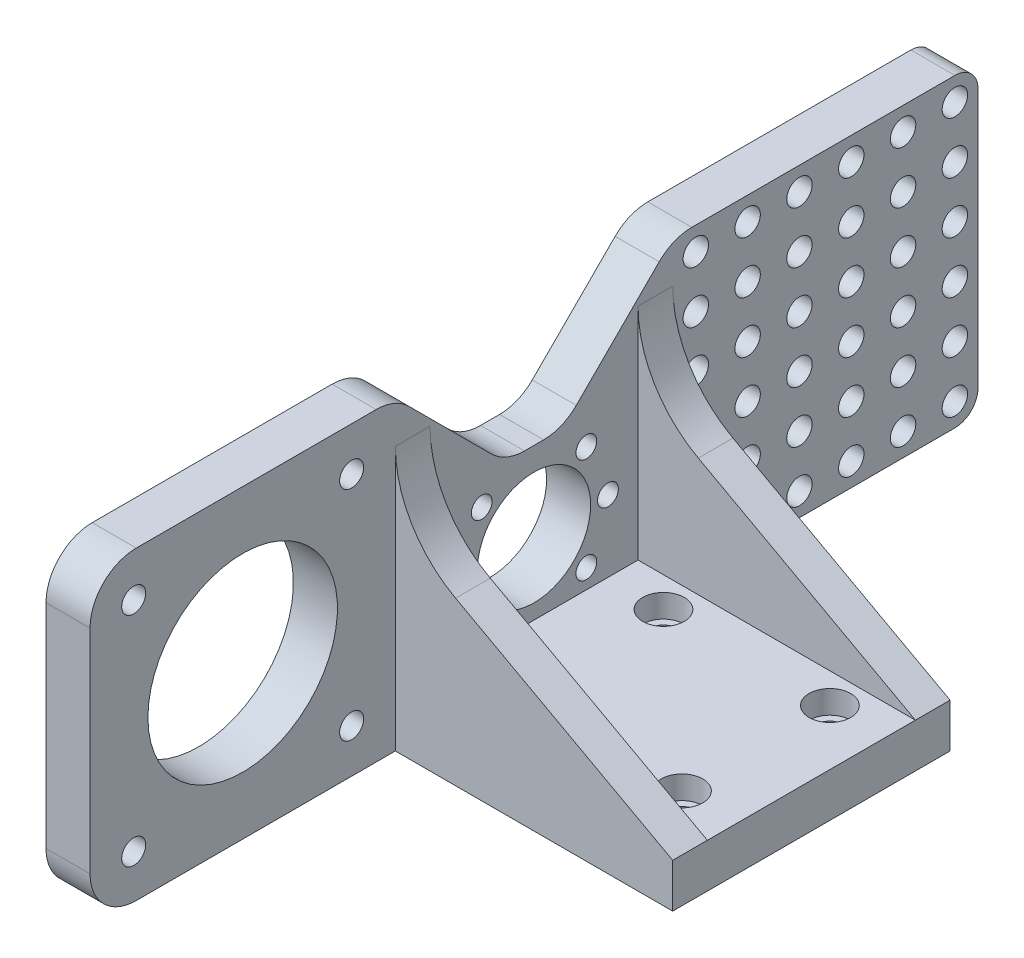
from build123d import *

# Parameters (mm, degrees)
SKETCH1_W           = 60
SKETCH1_H           = 60
SKETCH1_R           = 2.95
BOSS_EXTRUDE1_DEPTH = 9.525
SKETCH2_R           = 4.5
CUT_EXTRUDE1_DEPTH  = 5
SKETCH3_W           = 60
SKETCH3_H           = 42.25
SKETCH3_R           = 12.25
SKETCH3_R_2         = 2.25
BOSS_EXTRUDE2_DEPTH = 9.525
SKETCH4_W           = 66.04
SKETCH4_H           = 66.04
SKETCH4_R           = 2.6
SKETCH4_R_2         = 20.5
SKETCH4_R_3         = 2.75
BOSS_EXTRUDE3_DEPTH = 9.525
BOSS_EXTRUDE4_DEPTH = 7.5
CHAMFER1_SIZE       = 23.79
FILLET1_R           = 10
FILLET2_R           = 5
FILLET3_R           = 25


with BuildPart() as part:
    # Sketch1 → Boss-Extrude1 (new body)
    with BuildSketch(Plane(origin=(0, 0, 0), x_dir=(1, 0, 0), z_dir=(0, 1, 0))):
        with Locations((30, 30)):
            Rectangle(SKETCH1_W, SKETCH1_H)
        with Locations(Location((12, 14, 0), (0, 0, 90))):
            Circle(SKETCH1_R, mode=Mode.SUBTRACT)
        with Locations(Location((12, 46, 0), (0, 0, 90))):
            Circle(SKETCH1_R, mode=Mode.SUBTRACT)
        with Locations(Location((48, 46, 0), (0, 0, 90))):
            Circle(SKETCH1_R, mode=Mode.SUBTRACT)
        with Locations(Location((48, 14, 0), (0, 0, 90))):
            Circle(SKETCH1_R, mode=Mode.SUBTRACT)
    extrude(amount=BOSS_EXTRUDE1_DEPTH)

    # Sketch2 → Cut-Extrude1 (cut)
    with BuildSketch(Plane(origin=(0, 9.525, 0), x_dir=(1, 0, 0), z_dir=(0, 1, 0))):
        with Locations(Location((12, 14, 0), (0, 0, 270))):
            Circle(SKETCH2_R)
        with Locations(Location((12, 46, 0), (0, 0, 270))):
            Circle(SKETCH2_R)
        with Locations(Location((48, 46, 0), (0, 0, 270))):
            Circle(SKETCH2_R)
        with Locations(Location((48, 14, 0), (0, 0, 270))):
            Circle(SKETCH2_R)
    extrude(amount=-CUT_EXTRUDE1_DEPTH, mode=Mode.SUBTRACT)

    # Sketch3 → Boss-Extrude2 (add)
    with BuildSketch(Plane.ZY):
        with Locations((-30, 21.125)):
            Rectangle(SKETCH3_W, SKETCH3_H)
        with Locations(Location((-30, 25, 0), (0, 0, 180))):
            Circle(SKETCH3_R, mode=Mode.SUBTRACT)
        with Locations(Location((-18.686291501, 36.313708499, 0), (0, 0, 180))):
            Circle(SKETCH3_R_2, mode=Mode.SUBTRACT)
        with Locations(Location((-14, 25, 0), (0, 0, 180))):
            Circle(SKETCH3_R_2, mode=Mode.SUBTRACT)
        with Locations(Location((-18.686291501, 13.686291501, 0), (0, 0, 180))):
            Circle(SKETCH3_R_2, mode=Mode.SUBTRACT)
        with Locations(Location((-41.313708499, 13.686291501, 0), (0, 0, 180))):
            Circle(SKETCH3_R_2, mode=Mode.SUBTRACT)
        with Locations(Location((-46, 25, 0), (0, 0, 180))):
            Circle(SKETCH3_R_2, mode=Mode.SUBTRACT)
        with Locations(Location((-41.313708499, 36.313708499, 0), (0, 0, 180))):
            Circle(SKETCH3_R_2, mode=Mode.SUBTRACT)
    extrude(amount=BOSS_EXTRUDE2_DEPTH)

    # Sketch4 → Boss-Extrude3 (add)
    # profile 1 of 2: a face of its own
    with BuildSketch(Plane.ZY.offset(9.525)):
        with Locations((33.02, 33.02)):
            Rectangle(SKETCH4_W, SKETCH4_H)
        with Locations((56.59, 56.59)):
            Circle(SKETCH4_R, mode=Mode.SUBTRACT)
        with Locations((9.45, 56.59)):
            Circle(SKETCH4_R, mode=Mode.SUBTRACT)
        with Locations((9.45, 9.45)):
            Circle(SKETCH4_R, mode=Mode.SUBTRACT)
        with Locations((56.59, 9.45)):
            Circle(SKETCH4_R, mode=Mode.SUBTRACT)
        with Locations((33.02, 33.02)):
            Circle(SKETCH4_R_2, mode=Mode.SUBTRACT)
    # profile 2 of 2: a face of its own
    with BuildSketch(Plane.ZY.offset(9.525)):
        with Locations((-93.02, 33.02)):
            Rectangle(SKETCH4_W, SKETCH4_H)
        with Locations((-121.04, 61.04)):
            Circle(SKETCH4_R_3, mode=Mode.SUBTRACT)
        with Locations((-109.832, 61.04)):
            Circle(SKETCH4_R_3, mode=Mode.SUBTRACT)
        with Locations((-98.624, 61.04)):
            Circle(SKETCH4_R_3, mode=Mode.SUBTRACT)
        with Locations((-87.416, 61.04)):
            Circle(SKETCH4_R_3, mode=Mode.SUBTRACT)
        with Locations((-76.208, 61.04)):
            Circle(SKETCH4_R_3, mode=Mode.SUBTRACT)
        with Locations((-65, 61.04)):
            Circle(SKETCH4_R_3, mode=Mode.SUBTRACT)
        with Locations((-109.832, 49.832)):
            Circle(SKETCH4_R_3, mode=Mode.SUBTRACT)
        with Locations((-98.624, 49.832)):
            Circle(SKETCH4_R_3, mode=Mode.SUBTRACT)
        with Locations((-87.416, 49.832)):
            Circle(SKETCH4_R_3, mode=Mode.SUBTRACT)
        with Locations((-76.208, 49.832)):
            Circle(SKETCH4_R_3, mode=Mode.SUBTRACT)
        with Locations((-65, 49.832)):
            Circle(SKETCH4_R_3, mode=Mode.SUBTRACT)
        with Locations((-109.832, 38.624)):
            Circle(SKETCH4_R_3, mode=Mode.SUBTRACT)
        with Locations((-98.624, 38.624)):
            Circle(SKETCH4_R_3, mode=Mode.SUBTRACT)
        with Locations((-87.416, 38.624)):
            Circle(SKETCH4_R_3, mode=Mode.SUBTRACT)
        with Locations((-76.208, 38.624)):
            Circle(SKETCH4_R_3, mode=Mode.SUBTRACT)
        with Locations((-65, 38.624)):
            Circle(SKETCH4_R_3, mode=Mode.SUBTRACT)
        with Locations((-109.832, 27.416)):
            Circle(SKETCH4_R_3, mode=Mode.SUBTRACT)
        with Locations((-98.624, 27.416)):
            Circle(SKETCH4_R_3, mode=Mode.SUBTRACT)
        with Locations((-87.416, 27.416)):
            Circle(SKETCH4_R_3, mode=Mode.SUBTRACT)
        with Locations((-76.208, 27.416)):
            Circle(SKETCH4_R_3, mode=Mode.SUBTRACT)
        with Locations((-65, 27.416)):
            Circle(SKETCH4_R_3, mode=Mode.SUBTRACT)
        with Locations((-109.832, 16.208)):
            Circle(SKETCH4_R_3, mode=Mode.SUBTRACT)
        with Locations((-98.624, 16.208)):
            Circle(SKETCH4_R_3, mode=Mode.SUBTRACT)
        with Locations((-87.416, 16.208)):
            Circle(SKETCH4_R_3, mode=Mode.SUBTRACT)
        with Locations((-76.208, 16.208)):
            Circle(SKETCH4_R_3, mode=Mode.SUBTRACT)
        with Locations((-65, 16.208)):
            Circle(SKETCH4_R_3, mode=Mode.SUBTRACT)
        with Locations((-109.832, 5)):
            Circle(SKETCH4_R_3, mode=Mode.SUBTRACT)
        with Locations((-98.624, 5)):
            Circle(SKETCH4_R_3, mode=Mode.SUBTRACT)
        with Locations((-87.416, 5)):
            Circle(SKETCH4_R_3, mode=Mode.SUBTRACT)
        with Locations((-76.208, 5)):
            Circle(SKETCH4_R_3, mode=Mode.SUBTRACT)
        with Locations((-65, 5)):
            Circle(SKETCH4_R_3, mode=Mode.SUBTRACT)
        with Locations((-121.04, 49.832)):
            Circle(SKETCH4_R_3, mode=Mode.SUBTRACT)
        with Locations((-121.04, 38.624)):
            Circle(SKETCH4_R_3, mode=Mode.SUBTRACT)
        with Locations((-121.04, 27.416)):
            Circle(SKETCH4_R_3, mode=Mode.SUBTRACT)
        with Locations((-121.04, 16.208)):
            Circle(SKETCH4_R_3, mode=Mode.SUBTRACT)
        with Locations((-121.04, 5)):
            Circle(SKETCH4_R_3, mode=Mode.SUBTRACT)
    extrude(amount=-BOSS_EXTRUDE3_DEPTH)

    # Sketch5 → Boss-Extrude4 (add)
    with BuildSketch(Plane.XY):
        Polygon((60, 9.525), (0, 42.25), (0, 9.525), align=None)
    boss_extrude4 = extrude(amount=-BOSS_EXTRUDE4_DEPTH)

    # Mirror1: Boss-Extrude4 across plane
    add(boss_extrude4.mirror(Plane.XY.offset(-30)))

    # Chamfer1
    # the kernel refuses this chamfer: 23.79 mm, written as the material it adds along each edge
    with BuildSketch(Plane(origin=(0, 42.25, -60), x_dir=(0, 0.9996219169112968, -0.02749587661058678), z_dir=(-1, 0, 0))) as chamfer1_piece_1_section:
        Polygon((CHAMFER1_SIZE * 0.999621916911, -CHAMFER1_SIZE * 0.0274958766106), (-CHAMFER1_SIZE * 0.0274958766106, -CHAMFER1_SIZE * 0.999621916911), (0, 0), align=None)
    chamfer1_piece_1 = extrude(amount=9.525, mode=Mode.PRIVATE)
    chamfer1_piece_1 = split(chamfer1_piece_1, bisect_by=Plane(origin=(-4.388268078, 66.04, -53.256936761), z_dir=(0, -1, 0)), keep=Keep.TOP, mode=Mode.PRIVATE)
    add(chamfer1_piece_1)
    with BuildSketch(Plane(origin=(0, 42.25, 0), x_dir=(0, 0.9996219169112968, 0.027495876610586938), z_dir=(-1, 0, 0))) as chamfer1_piece_2_section:
        Polygon((CHAMFER1_SIZE * 0.999621916911, CHAMFER1_SIZE * 0.0274958766106), (-CHAMFER1_SIZE * 0.0274958766106, CHAMFER1_SIZE * 0.999621916911), (0, 0), align=None)
    chamfer1_piece_2 = extrude(amount=9.525, mode=Mode.PRIVATE)
    chamfer1_piece_2 = split(chamfer1_piece_2, bisect_by=Plane(origin=(-4.388268078, 66.04, -6.743063239), z_dir=(0, -1, 0)), keep=Keep.TOP, mode=Mode.PRIVATE)
    add(chamfer1_piece_2)

    # Fillet1
    fillet1_edges = [part.edges().sort_by_distance(p)[0] for p in [
        (-4.7625, 66.04, -60),
        (-4.7625, 42.25, -23.79),
        (-4.7625, 42.25, -36.21),
        (-4.7625, 66.04, 0),
        (-4.7625, 66.04, 66.04),
        (-4.7625, 0, 66.04),
    ]]
    fillet(fillet1_edges, radius=FILLET1_R)

    # Fillet2
    fillet2_edges = [part.edges().sort_by_distance(p)[0] for p in [
        (-4.7625, 0, -126.04),
        (-4.7625, 66.04, -126.04),
    ]]
    fillet(fillet2_edges, radius=FILLET2_R)

    # Fillet3
    fillet3_edges = [part.edges().sort_by_distance(p)[0] for p in [
        (0, 42.25, -56.25),
        (0, 42.25, -3.75),
    ]]
    fillet(fillet3_edges, radius=FILLET3_R)


solid = part.part
